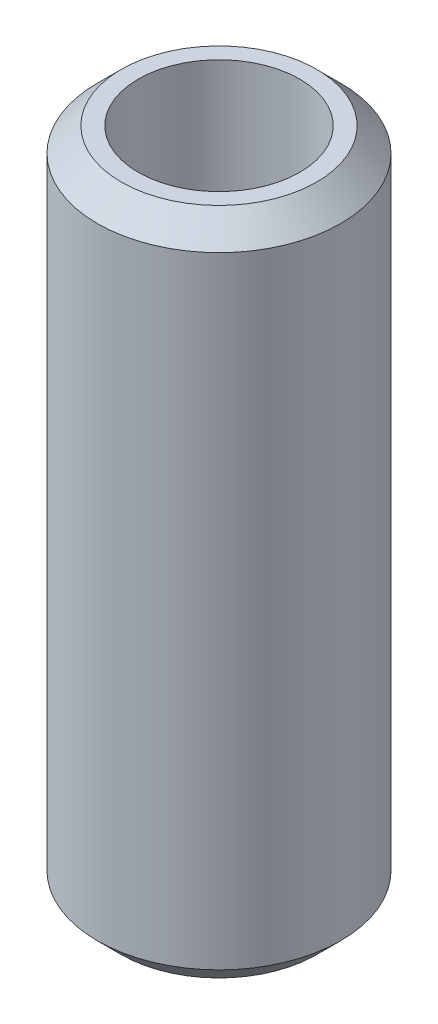
from build123d import *

# Parameters (mm, degrees)
SKETCH2_R           = 12.7
SKETCH2_R_2         = 8.433976834
BOSS_EXTRUDE1_DEPTH = 34.925
CHAMFER1_SIZE       = 2.5


with BuildPart() as part:
    # Sketch2 → Boss-Extrude1 (new, symmetric)
    with BuildSketch(Plane(origin=(0, 0, 0), x_dir=(1, 0, 0), z_dir=(0, 1, 0))):
        Circle(SKETCH2_R)
        Circle(SKETCH2_R_2, mode=Mode.SUBTRACT)
    extrude(amount=BOSS_EXTRUDE1_DEPTH, both=True)

    # Chamfer1
    chamfer1_edges = [part.edges().sort_by_distance(p)[0] for p in [
        (-12.7, -34.925, 0),
        (-12.7, 34.925, 0),
    ]]
    chamfer(chamfer1_edges, length=CHAMFER1_SIZE)


solid = part.part
